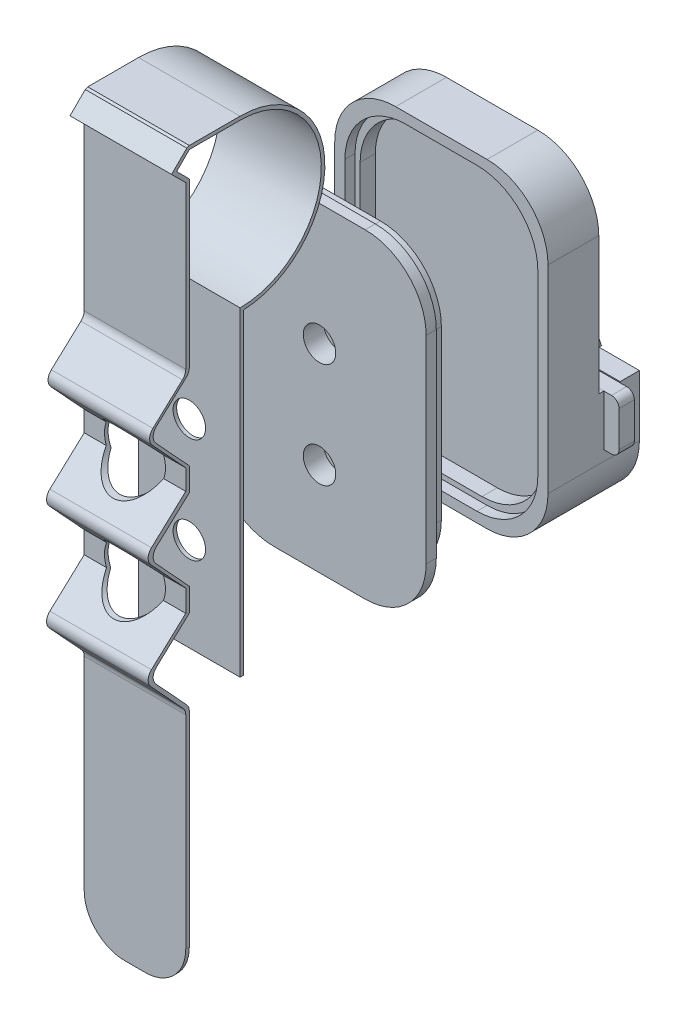
from build123d import *

# Parameters (mm, degrees)
SKETCH_2_W               = 42
SKETCH_2_H               = 63
EXTRUDE_1_DEPTH          = 10
SKETCH_3_W               = 42
SKETCH_3_H               = 24
EXTRUDE_2_DEPTH          = 8
EXTRUDE_3_DEPTH          = 32
SKETCH_5_R               = 0.74
CUT_EXTRUDE_1_DEPTH      = 10
FILLET_1_R               = 3
CUT_EXTRUDE_2_DEPTH      = 7
CUT_EXTRUDE_3_DEPTH      = 7
SKETCH_8_R               = 1.6
CUT_EXTRUDE_4_DEPTH      = 5
FILLET_6_R               = 12
EXTRUDE_START            = -4
EXTRUDE_6806_OUTLINE_R   = 1.6
EXTRUDE_6806_DEPTH       = 3
FILLET_2_R               = 1.5
EXTRUDE_START_2          = 3
SKETCH_11_W              = 22
SKETCH_11_H              = 6
EXTRUDE_6_DEPTH          = 0.2
EXTRUDE_START_3          = 3.8
SKETCH_12_W              = 22
SKETCH_12_H              = 6
SKETCH_12_R              = 1.64645215
SKETCH_12_R_2            = 1.6
EXTRUDE_7_DEPTH          = 3.8
CHAMFER_2_SIZE           = 1
SKETCH_25_R              = 1.64645215
SKETCH_25_R_2            = 1.6
CUT_EXTRUDE_12_DEPTH     = 4.2
EXTRUDE_9444_DEPTH       = 3.8
CUT_EXTRUDE_5_DEPTH      = 5
CUT_EXTRUDE_6_DEPTH      = 2
EXTRUDE_START_4          = 20
SKETCH_16_W              = 42
SKETCH_16_H              = 63
EXTRUDE_9_DEPTH          = 4
EXTRUDE_10_DEPTH         = 2
CUT_EXTRUDE_START        = -2
SKETCH_20_W              = 42
SKETCH_20_H              = 63
CUT_EXTRUDE_7_DEPTH      = 2
EXTRUDE_11_DEPTH         = 10
EXTRUDE_11_DEPTH_BACK    = 10
FILLET_3_R               = 2
FILLET_4_R               = 2
CUT_EXTRUDE_8_DEPTH      = 12
CUT_EXTRUDE_8_DEPTH_BACK = 8
SKETCH_22_R              = 6
SKETCH_23_R              = 3.2
CUT_EXTRUDE_10_DEPTH     = 0.7
SKETCH_24_R              = 3.2
CUT_EXTRUDE_11_DEPTH     = 6
FILLET_5_R               = 8
FILLET_7_R               = 12


# Read off the part's stored shape, not the designer's step: 弹性件
with BuildPart() as part:
    # 草图2 → 凸台-拉伸1 (new body)
    with BuildSketch(Plane.XY):
        Rectangle(SKETCH_2_W, SKETCH_2_H)
    extrude(amount=EXTRUDE_1_DEPTH)

    # 草图3 → 凸台-拉伸2 (add)
    with BuildSketch(Plane(origin=(0, 0, 0), x_dir=(-1, 0, 0), z_dir=(0, 0, -1))):
        with Locations((0, -19.5)):
            Rectangle(SKETCH_3_W, SKETCH_3_H)
    extrude(amount=EXTRUDE_2_DEPTH)

    # 草图4 → 凸台-拉伸3 (add)
    with BuildSketch(Plane(origin=(0, -7.5, 0), x_dir=(1, 0, 0), z_dir=(0, 1, 0))):
        Polygon((-3.5, 0), (0, 0), (0, 3), (-5.5, 3), align=None)
        Polygon((0, 3), (0, 0), (3.5, 0), (5.5, 3), align=None)
    extrude(amount=EXTRUDE_3_DEPTH)

    # 草图5 → 切除-拉伸1 (cut)
    with BuildSketch(Plane(origin=(0, -7.5, 0), x_dir=(1, 0, 0), z_dir=(0, 1, 0))):
        with Locations(Location((-3.81, 4.25, 0), (0, 0, 270))):
            Circle(SKETCH_5_R)
        with Locations(Location((-1.27, 4.25, 0), (0, 0, 270))):
            Circle(SKETCH_5_R)
        with Locations(Location((1.27, 4.25, 0), (0, 0, 270))):
            Circle(SKETCH_5_R)
        with Locations(Location((3.81, 4.25, 0), (0, 0, 270))):
            Circle(SKETCH_5_R)
    extrude(amount=-CUT_EXTRUDE_1_DEPTH, mode=Mode.SUBTRACT)

    # 圆角1
    # the kernel refuses this fillet: 3 mm, written as the material it takes off along each edge
    with BuildSketch(Plane(origin=(-9.660251472, 24.5, -9.240377208), x_dir=(0, -1, 0), z_dir=(0.5547001962252293, 0, 0.8320502943378436))) as fillet_1_piece_1_section:
        with BuildLine():
            CenterArc((FILLET_1_R, FILLET_1_R), FILLET_1_R, 180, 90)
            Line((0, FILLET_1_R), (0, 0))
            Line((0, 0), (FILLET_1_R, 0))
        make_face()
    fillet_1_piece_1 = extrude(amount=18.605551275, mode=Mode.PRIVATE)
    fillet_1_piece_1 = split(fillet_1_piece_1, bisect_by=Plane(origin=(-5.864892725, 23.83506759, 0), z_dir=(0, 0, -1)), keep=Keep.TOP, mode=Mode.PRIVATE)
    add(fillet_1_piece_1, mode=Mode.SUBTRACT)
    with BuildSketch(Plane(origin=(-0.660251472, 24.5, 6.240377208), x_dir=(-0.8320502943378437, 0, -0.5547001962252291), z_dir=(0.5547001962252291, 0, -0.8320502943378437))) as fillet_1_piece_2_section:
        with BuildLine():
            CenterArc((FILLET_1_R, -FILLET_1_R), FILLET_1_R, 90, 90)
            Line((0, -FILLET_1_R), (0, 0))
            Line((0, 0), (FILLET_1_R, 0))
        make_face()
    fillet_1_piece_2 = extrude(amount=18.605551275, mode=Mode.PRIVATE)
    fillet_1_piece_2 = split(fillet_1_piece_2, bisect_by=Plane(origin=(5.864892725, 23.83506759, 0), z_dir=(0, 0, -1)), keep=Keep.TOP, mode=Mode.PRIVATE)
    add(fillet_1_piece_2, mode=Mode.SUBTRACT)

    # 草图6 → 切除-拉伸2 (cut)
    with BuildSketch(Plane(origin=(0, 0, -8), x_dir=(-1, 0, 0), z_dir=(0, 0, -1))):
        with BuildLine():
            Line((-17.55, -7.5), (-21, -7.5))
            Line((-21, -7.5), (-21, -17.5))
            Line((-21, -17.5), (-19, -17.5))
            Line((-19, -17.5), (-19, -21.5))
            ThreePointArc((-19, -21.5), (-16.656854249, -27.156854249), (-11, -29.5))
            Line((-11, -29.5), (-9.55, -29.5))
            Line((-9.55, -29.5), (0, -29.5))
            Line((0, -29.5), (9.55, -29.5))
            Line((9.55, -29.5), (11, -29.5))
            ThreePointArc((11, -29.5), (16.656854249, -27.156854249), (19, -21.5))
            Line((19, -21.5), (19, -17.5))
            Line((19, -17.5), (21, -17.5))
            Line((21, -17.5), (21, -7.5))
            Line((21, -7.5), (17.55, -7.5))
            Line((17.55, -7.5), (14.55, -7.5))
            Line((14.55, -7.5), (9.55, -7.5))
            Line((9.55, -7.5), (9.55, -19.5))
            ThreePointArc((9.55, -19.5), (12.378427125, -20.671572875), (13.55, -23.5))
            ThreePointArc((13.55, -23.5), (11.55, -25.5), (9.55, -23.5))
            Line((9.55, -23.5), (0, -23.5))
            Line((0, -23.5), (-9.55, -23.5))
            ThreePointArc((-9.55, -23.5), (-11.55, -25.5), (-13.55, -23.5))
            ThreePointArc((-13.55, -23.5), (-12.378427125, -20.671572875), (-9.55, -19.5))
            Line((-9.55, -19.5), (-9.55, -7.5))
            Line((-9.55, -7.5), (-14.55, -7.5))
            Line((-14.55, -7.5), (-17.55, -7.5))
        make_face()
    extrude(amount=-CUT_EXTRUDE_2_DEPTH, mode=Mode.SUBTRACT)

    # 草图7 → 切除-拉伸3 (cut)
    with BuildSketch(Plane(origin=(0, 0, -8), x_dir=(-1, 0, 0), z_dir=(0, 0, -1))):
        with BuildLine():
            Line((-7.55, -7.5), (-9.55, -7.5))
            Line((-9.55, -7.5), (-9.55, -19.5))
            ThreePointArc((-9.55, -19.5), (-12.378427125, -20.671572875), (-13.55, -23.5))
            ThreePointArc((-13.55, -23.5), (-12.964213562, -24.914213562), (-11.55, -25.5))
            ThreePointArc((-11.55, -25.5), (-10.135786438, -24.914213562), (-9.55, -23.5))
            Line((-9.55, -23.5), (-7.55, -23.5))
            Line((-7.55, -23.5), (-7.55, -7.5))
        make_face()
        with BuildLine():
            Line((9.55, -7.5), (7.55, -7.5))
            Line((7.55, -7.5), (7.55, -23.5))
            Line((7.55, -23.5), (9.55, -23.5))
            ThreePointArc((9.55, -23.5), (10.135786438, -24.914213562), (11.55, -25.5))
            ThreePointArc((11.55, -25.5), (12.964213562, -24.914213562), (13.55, -23.5))
            ThreePointArc((13.55, -23.5), (12.378427125, -20.671572875), (9.55, -19.5))
            Line((9.55, -19.5), (9.55, -7.5))
        make_face()
    extrude(amount=-CUT_EXTRUDE_3_DEPTH, mode=Mode.SUBTRACT)

    # 草图8 → 切除-拉伸4 (cut)
    with BuildSketch(Plane(origin=(0, 0, -1), x_dir=(-1, 0, 0), z_dir=(0, 0, -1))):
        with Locations((-6, -26.5)):
            Circle(SKETCH_8_R)
        with Locations((6, -26.5)):
            Circle(SKETCH_8_R)
    extrude(amount=-CUT_EXTRUDE_4_DEPTH, mode=Mode.SUBTRACT)

    # 圆角6
    fillet_6_edges = [part.edges().sort_by_distance(p)[0] for p in [
        (21, -31.5, 1),
        (-21, -31.5, 1),
        (-21, 31.5, 5),
        (21, 31.5, 5),
    ]]
    fillet(fillet_6_edges, radius=FILLET_6_R)



with BuildPart() as body_2:
    # Extrude 6806 outline → Extrude 6806 (new body)
    with BuildSketch(Plane.XY.offset(EXTRUDE_START)):
        with BuildLine():
            Line((9.55, 12.5), (9.55, -19.5))
            ThreePointArc((9.55, -19.5), (12.378427125, -20.671572875), (13.55, -23.5))
            ThreePointArc((13.55, -23.5), (11.55, -25.5), (9.55, -23.5))
            Line((9.55, -23.5), (-9.55, -23.5))
            ThreePointArc((-9.55, -23.5), (-11.55, -25.5), (-13.55, -23.5))
            ThreePointArc((-13.55, -23.5), (-12.378427125, -20.671572875), (-9.55, -19.5))
            Line((-9.55, -19.5), (-9.55, 12.5))
            Line((-9.55, 12.5), (-17.55, -3))
            Line((-17.55, -3), (-14.55, -3))
            Line((-14.55, -3), (-14.55, -7.5))
            Line((-14.55, -7.5), (-24, -7.5))
            Line((-24, -7.5), (-24, -17.5))
            Line((-24, -17.5), (-19, -17.5))
            Line((-19, -17.5), (-19, -21.5))
            ThreePointArc((-19, -21.5), (-16.656854249, -27.156854249), (-11, -29.5))
            Line((-11, -29.5), (11, -29.5))
            ThreePointArc((11, -29.5), (16.656854249, -27.156854249), (19, -21.5))
            Line((19, -21.5), (19, -17.5))
            Line((19, -17.5), (24, -17.5))
            Line((24, -17.5), (24, -7.5))
            Line((24, -7.5), (14.55, -7.5))
            Line((14.55, -7.5), (14.55, -3))
            Line((14.55, -3), (17.55, -3))
            Line((17.55, -3), (9.55, 12.5))
        make_face()
        with Locations((-6, -26.5)):
            Circle(EXTRUDE_6806_OUTLINE_R, mode=Mode.SUBTRACT)
        with Locations((6, -26.5)):
            Circle(EXTRUDE_6806_OUTLINE_R, mode=Mode.SUBTRACT)
    extrude(amount=EXTRUDE_6806_DEPTH)

    # 圆角2
    fillet_2_edges = [body_2.edges().sort_by_distance(p)[0] for p in [
        (24, -7.5, -2.5),
        (24, -17.5, -2.5),
        (-24, -17.5, -2.5),
        (-24, -7.5, -2.5),
    ]]
    fillet(fillet_2_edges, radius=FILLET_2_R)


with BuildPart() as body_3:
    # 草图11 → 凸台-拉伸6 (new body)
    with BuildSketch(Plane(origin=(0, 0, -1), x_dir=(-1, 0, 0), z_dir=(0, 0, -1)).offset(EXTRUDE_START_2)):
        with Locations((0, -26.5)):
            Rectangle(SKETCH_11_W, SKETCH_11_H)
    extrude(amount=EXTRUDE_6_DEPTH)


with BuildPart() as part_1:
    add(part.part)

    add(body_3.part)  # 凸台-拉伸7 merges body 3
    # 草图12 → 凸台-拉伸7 (add)
    # profile 1 of 3: a face of its own
    with BuildSketch(Plane(origin=(0, 0, -4.2), x_dir=(-1, 0, 0), z_dir=(0, 0, -1)).offset(EXTRUDE_START_3)):
        with BuildLine():
            ThreePointArc((-19, -21.5), (-16.656854249, -27.156854249), (-11, -29.5))
            Line((-11, -29.5), (-11, -23.5))
            Line((-11, -23.5), (-7.55, -23.5))
            Line((-7.55, -23.5), (-7.55, -14.282140206))
            Line((-7.55, -14.282140206), (-7.55, -7.5))
            Line((-7.55, -7.5), (-21, -7.5))
            Line((-21, -7.5), (-21, -17.5))
            Line((-21, -17.5), (-19, -17.5))
            Line((-19, -17.5), (-19, -21.5))
        make_face()
    # profile 2 of 3: a face of its own
    with BuildSketch(Plane(origin=(0, 0, -4.2), x_dir=(-1, 0, 0), z_dir=(0, 0, -1)).offset(EXTRUDE_START_3)):
        with Locations((0, -26.5)):
            Rectangle(SKETCH_12_W, SKETCH_12_H)
        with Locations(Location((6, -26.5, 0), (0, 0, 180))):
            Circle(SKETCH_12_R, mode=Mode.SUBTRACT)
        with Locations(Location((-6, -26.5, 0), (0, 0, 180))):
            Circle(SKETCH_12_R_2, mode=Mode.SUBTRACT)
    # profile 3 of 3: a face of its own
    with BuildSketch(Plane(origin=(0, 0, -4.2), x_dir=(-1, 0, 0), z_dir=(0, 0, -1)).offset(EXTRUDE_START_3)):
        with BuildLine():
            Line((11, -23.5), (11, -29.5))
            ThreePointArc((11, -29.5), (16.656854249, -27.156854249), (19, -21.5))
            Line((19, -21.5), (19, -17.5))
            Line((19, -17.5), (21, -17.5))
            Line((21, -17.5), (21, -7.5))
            Line((21, -7.5), (7.55, -7.5))
            Line((7.55, -7.5), (7.55, -23.5))
            Line((7.55, -23.5), (11, -23.5))
        make_face()
    extrude(amount=-EXTRUDE_7_DEPTH)

    # 倒角2
    chamfer_2_edges = [part_1.edges().sort_by_distance(p)[0] for p in [
        (-7.64645215, -26.5, -8),
        (4.4, -26.5, -8),
    ]]
    chamfer(chamfer_2_edges, length=CHAMFER_2_SIZE)

    # 草图25 → 切除-拉伸12 (cut)
    with BuildSketch(Plane(origin=(0, 0, -8), x_dir=(-1, 0, 0), z_dir=(0, 0, -1))):
        with Locations(Location((6, -26.5, 0), (0, 0, 180))):
            Circle(SKETCH_25_R)
        with Locations(Location((-6, -26.5, 0), (0, 0, 180))):
            Circle(SKETCH_25_R_2)
    extrude(amount=-CUT_EXTRUDE_12_DEPTH, mode=Mode.SUBTRACT)

    # Chamfer 9053
    # the kernel refuses this chamfer: 17.145078454, 1.5 mm, written as the material it takes off along each edge
    with BuildSketch(Plane(origin=(7.55, -7.5, -4.2), x_dir=(0.0033526157940329347, -0.9999943799678764, 0), z_dir=(0, 0, 1))) as chamfer_9053_piece_1_section:
        with BuildLine():
            Line((17.8283721, 0), (-0.688418926, -1.557472431))
            Line((-0.688418926, -1.557472431), (-1.031318568, -1.556322814))
            ThreePointArc((-1.031318568, -1.556322814), (-0.3455143, -0.778731841), (-0.342899642, 0.001149617))
            Line((-0.342899642, 0.001149617), (0.001149617, 0.342899642))
            ThreePointArc((0.001149617, 0.342899642), (8.915235472, 0.313013969), (17.829521718, 0.342899642))
            Line((17.829521718, 0.342899642), (17.8283721, 0))
        make_face()
    chamfer_9053_piece_1 = extrude(amount=3.2, mode=Mode.PRIVATE)
    chamfer_9053_piece_1 = split(chamfer_9053_piece_1, bisect_by=Plane(origin=(7.231842313, -23.5, -2.6), z_dir=(0, 1, 0)), keep=Keep.TOP, mode=Mode.PRIVATE)
    add(chamfer_9053_piece_1, mode=Mode.SUBTRACT)
    with BuildSketch(Plane(origin=(-7.55, -7.5, -4.2), x_dir=(-0.003352615794033234, -0.9999943799678764, 0), z_dir=(0, 0, 1))) as chamfer_9053_piece_2_section:
        with BuildLine():
            Line((17.8283721, 0), (-0.688418926, 1.557472431))
            Line((-0.688418926, 1.557472431), (-1.031318568, 1.556322814))
            ThreePointArc((-1.031318568, 1.556322814), (-0.3455143, 0.778731841), (-0.342899642, -0.001149617))
            Line((-0.342899642, -0.001149617), (0.001149617, -0.342899642))
            ThreePointArc((0.001149617, -0.342899642), (8.915235472, -0.313013969), (17.829521718, -0.342899642))
            Line((17.829521718, -0.342899642), (17.8283721, 0))
        make_face()
    chamfer_9053_piece_2 = extrude(amount=3.2, mode=Mode.PRIVATE)
    chamfer_9053_piece_2 = split(chamfer_9053_piece_2, bisect_by=Plane(origin=(-7.231842313, -23.5, -2.6), z_dir=(0, 1, 0)), keep=Keep.TOP, mode=Mode.PRIVATE)
    add(chamfer_9053_piece_2, mode=Mode.SUBTRACT)

    # 草图13 → Extrude 9444 (add)
    with BuildSketch(Plane(origin=(0, 0, -8), x_dir=(-1, 0, 0), z_dir=(0, 0, -1))):
        Polygon((-6.05, -7.5), (-7.449818616, -23.5), (-7.55, -23.5), (-7.55, -7.5), align=None)
        Polygon((6.05, -7.5), (7.55, -7.5), (7.55, -23.5), (7.449818616, -23.5), align=None)
    extrude(amount=-EXTRUDE_9444_DEPTH)

    # 草图14 → 切除-拉伸5 (cut)
    with BuildSketch(Plane.XY.offset(10)):
        with BuildLine():
            Line((-6, -28.5), (6, -28.5))
            ThreePointArc((6, -28.5), (14.485281374, -24.985281374), (18, -16.5))
            Line((18, -16.5), (18, 16.5))
            ThreePointArc((18, 16.5), (14.485281374, 24.985281374), (6, 28.5))
            Line((6, 28.5), (-6, 28.5))
            ThreePointArc((-6, 28.5), (-14.485281374, 24.985281374), (-18, 16.5))
            Line((-18, 16.5), (-18, -16.5))
            ThreePointArc((-18, -16.5), (-14.485281374, -24.985281374), (-6, -28.5))
        make_face()
    extrude(amount=-CUT_EXTRUDE_5_DEPTH, mode=Mode.SUBTRACT)

    # 草图15 → 切除-拉伸6 (cut)
    with BuildSketch(Plane.XY.offset(10)):
        with BuildLine():
            Line((-7, -29.5), (7, -29.5))
            ThreePointArc((7, -29.5), (15.485281374, -25.985281374), (19, -17.5))
            Line((19, -17.5), (19, 17.5))
            ThreePointArc((19, 17.5), (15.485281374, 25.985281374), (7, 29.5))
            Line((7, 29.5), (-7, 29.5))
            ThreePointArc((-7, 29.5), (-15.485281374, 25.985281374), (-19, 17.5))
            Line((-19, 17.5), (-19, -17.5))
            ThreePointArc((-19, -17.5), (-15.485281374, -25.985281374), (-7, -29.5))
        make_face()
    extrude(amount=-CUT_EXTRUDE_6_DEPTH, mode=Mode.SUBTRACT)


with BuildPart() as body_3_2:
    # 草图16 → 凸台-拉伸9 (new body)
    with BuildSketch(Plane.XY.offset(10).offset(EXTRUDE_START_4)):
        Rectangle(SKETCH_16_W, SKETCH_16_H)
    extrude(amount=EXTRUDE_9_DEPTH)

    # 草图20 → 切除-拉伸7 (cut)
    with BuildSketch(Plane(origin=(0, 0, 30), x_dir=(-1, 0, 0), z_dir=(0, 0, -1)).offset(CUT_EXTRUDE_START)):
        Rectangle(SKETCH_20_W, SKETCH_20_H)
        with BuildLine():
            Line((-7, -29.5), (7, -29.5))
            ThreePointArc((7, -29.5), (15.485281374, -25.985281374), (19, -17.5))
            Line((19, -17.5), (19, 17.5))
            ThreePointArc((19, 17.5), (15.485281374, 25.985281374), (7, 29.5))
            Line((7, 29.5), (-7, 29.5))
            ThreePointArc((-7, 29.5), (-15.485281374, 25.985281374), (-19, 17.5))
            Line((-19, 17.5), (-19, -17.5))
            ThreePointArc((-19, -17.5), (-15.485281374, -25.985281374), (-7, -29.5))
        make_face(mode=Mode.SUBTRACT)
    extrude(amount=CUT_EXTRUDE_7_DEPTH, mode=Mode.SUBTRACT)

    # 草图24 → 切除-拉伸11 (cut)
    with BuildSketch(Plane.XY.offset(34)):
        with Locations((0, 7.555855621)):
            Circle(SKETCH_24_R)
        with Locations((0, -13.112379601)):
            Circle(SKETCH_24_R)
    extrude(amount=-CUT_EXTRUDE_11_DEPTH, mode=Mode.SUBTRACT)

    # 圆角7
    fillet_7_edges = [body_3_2.edges().sort_by_distance(p)[0] for p in [
        (21, -31.5, 33),
        (-21, -31.5, 33),
        (-21, 31.5, 33),
        (21, 31.5, 33),
    ]]
    fillet(fillet_7_edges, radius=FILLET_7_R)


with BuildPart() as body_4:
    # 草图19 → 凸台-拉伸10 (new body)
    with BuildSketch(Plane(origin=(0, 0, 30), x_dir=(-1, 0, 0), z_dir=(0, 0, -1))):
        with BuildLine():
            Line((-6, -28.5), (6, -28.5))
            ThreePointArc((6, -28.5), (14.485281374, -24.985281374), (18, -16.5))
            Line((18, -16.5), (18, 16.5))
            ThreePointArc((18, 16.5), (14.485281374, 24.985281374), (6, 28.5))
            Line((6, 28.5), (-6, 28.5))
            ThreePointArc((-6, 28.5), (-14.485281374, 24.985281374), (-18, 16.5))
            Line((-18, 16.5), (-18, -16.5))
            ThreePointArc((-18, -16.5), (-14.485281374, -24.985281374), (-6, -28.5))
        make_face()
    extrude(amount=EXTRUDE_10_DEPTH)


with BuildPart() as body_5:
    # 草图21 → 凸台-拉伸11 (new, two sides: drawn at the far end of the back side and taken through both)
    with BuildSketch(Plane(origin=(0, 0, 0), x_dir=(0, 0, -1), z_dir=(1, 0, 0)).offset(-EXTRUDE_11_DEPTH_BACK)):
        with BuildLine():
            Line((-59.6372278, -31.5), (-59.6372278, 31.5))
            ThreePointArc((-59.6372278, 31.5), (-43.641058217, 47.14991619), (-58.9372278, 63.484680166))
            Line((-58.9372278, 63.484680166), (-59.6372278, 63.5))
            Line((-59.6372278, 63.5), (-69.6372278, 63.5))
            Line((-69.6372278, 63.5), (-72.1372278, 61))
            Line((-72.1372278, 61), (-69.6372278, 58.5))
            Line((-69.6372278, 58.5), (-69.6372278, 25.5))
            Line((-69.6372278, 25.5), (-77.579345381, 18.179037109))
            Line((-77.579345381, 18.179037109), (-69.6372278, 9.563062324))
            Line((-69.6372278, 9.563062324), (-69.6372278, 4.968468838))
            Line((-69.6372278, 4.968468838), (-77.579345381, -2.352494053))
            Line((-77.579345381, -2.352494053), (-69.6372278, -10.968468838))
            Line((-69.6372278, -10.968468838), (-69.6372278, -15.563062324))
            Line((-69.6372278, -15.563062324), (-77.579345381, -22.884025215))
            Line((-77.579345381, -22.884025215), (-69.6372278, -31.5))
            Line((-69.6372278, -31.5), (-69.6372278, -80.5))
            Line((-69.6372278, -80.5), (-70.3372278, -80.5))
            Line((-70.3372278, -80.5), (-70.3372278, -31.773408119))
            Line((-70.3372278, -31.773408119), (-78.56847611, -22.843771009))
            Line((-78.56847611, -22.843771009), (-70.3372278, -15.256290364))
            Line((-70.3372278, -15.256290364), (-70.3372278, -10.968468838))
            Line((-70.3372278, -10.968468838), (-78.56847611, -2.038831728))
            Line((-78.56847611, -2.038831728), (-70.3372278, 5.548648917))
            Line((-70.3372278, 5.548648917), (-70.3372278, 9.563062324))
            Line((-70.3372278, 9.563062324), (-78.279345381, 18.179037109))
            Line((-78.279345381, 18.179037109), (-70.3372278, 25.5))
            Line((-70.3372278, 25.5), (-70.3372278, 58.210050506))
            Line((-70.3372278, 58.210050506), (-73.127177293, 61))
            Line((-73.127177293, 61), (-70.132202547, 63.994974747))
            Line((-70.132202547, 63.994974747), (-69.6372278, 64.2))
            Line((-69.6372278, 64.2), (-59.6372278, 64.2))
            ThreePointArc((-59.6372278, 64.2), (-42.94089748, 47.850076926), (-58.9372278, 30.814677108))
            Line((-58.9372278, 30.814677108), (-58.9372278, -31.5))
            Line((-58.9372278, -31.5), (-59.6372278, -31.5))
        make_face()
    extrude(amount=EXTRUDE_11_DEPTH + EXTRUDE_11_DEPTH_BACK)

    # 圆角3
    fillet_3_edges = [body_5.edges().sort_by_distance(p)[0] for p in [
        (0, 18.179037109, 77.579345381),
        (0, -2.352494053, 77.579345381),
        (0, -22.884025215, 77.579345381),
    ]]
    fillet(fillet_3_edges, radius=FILLET_3_R)

    # 圆角4
    fillet_4_edges = [body_5.edges().sort_by_distance(p)[0] for p in [
        (0, 25.5, 69.6372278),
        (0, -31.5, 69.6372278),
        (0, -31.773408119, 70.3372278),
        (0, -22.843771009, 78.56847611),
        (0, -2.038831728, 78.56847611),
        (0, 18.179037109, 78.279345381),
        (0, 25.5, 70.3372278),
    ]]
    fillet(fillet_4_edges, radius=FILLET_4_R)

    # 草图22 → 切除-拉伸8 (cut, two sides: drawn at the far end of the back side and taken through both)
    with BuildSketch(Plane.XY.offset(70.3372278).offset(-CUT_EXTRUDE_8_DEPTH_BACK)):
        with Locations(Location((0, 7.555855621, 0), (0, 0, 160.45576938))):
            Circle(SKETCH_22_R)
        with Locations(Location((0, -13.112379601, 0), (0, 0, 159.064395454))):
            Circle(SKETCH_22_R)
    extrude(amount=CUT_EXTRUDE_8_DEPTH + CUT_EXTRUDE_8_DEPTH_BACK, mode=Mode.SUBTRACT)

    # 草图23 → 切除-拉伸10 (cut)
    with BuildSketch(Plane.XY.offset(59.6372278)):
        with Locations((0, 7.555855621)):
            Circle(SKETCH_23_R)
        with Locations((0, -13.112379601)):
            Circle(SKETCH_23_R)
    extrude(amount=-CUT_EXTRUDE_10_DEPTH, mode=Mode.SUBTRACT)

    # 圆角5
    fillet_5_edges = [body_5.edges().sort_by_distance(p)[0] for p in [
        (-10, -80.5, 69.9872278),
        (10, -80.5, 69.9872278),
    ]]
    fillet(fillet_5_edges, radius=FILLET_5_R)


solid = Compound([body_2.part, part_1.part, body_3_2.part, body_4.part, body_5.part])
